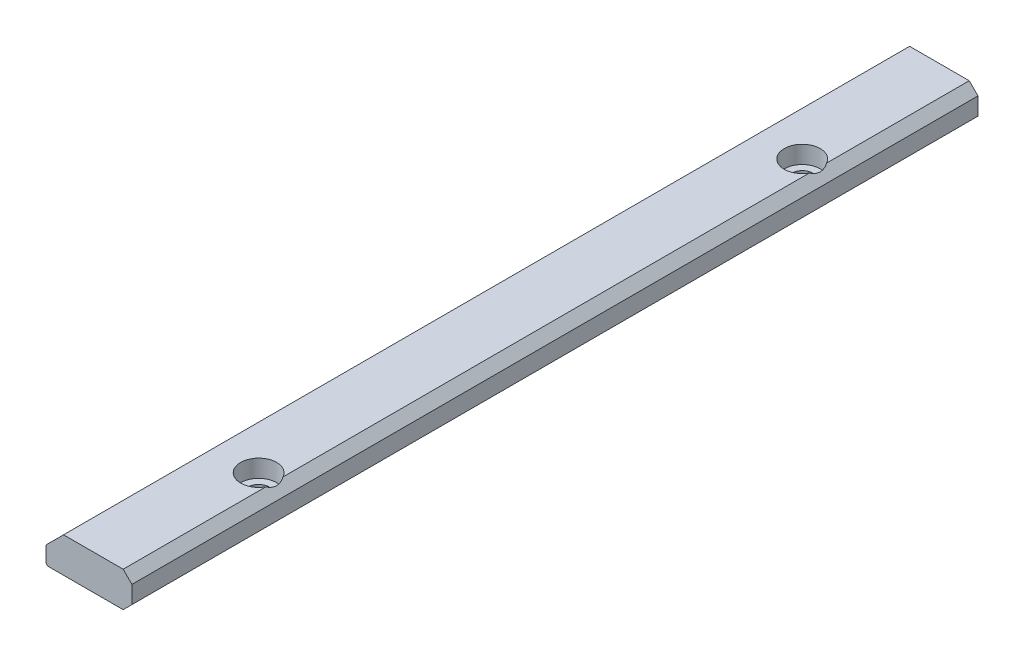
from build123d import *

# Parameters (mm, degrees)
EXTRUDE_1_DEPTH          = 96.5
CHAMFER_1_SIZE           = 1
CHAMFER_2_SIZE           = 1
CUT_EXTRUDE_1_DEPTH      = 98.010617976
CUT_EXTRUDE_1_DEPTH_BACK = 10
SKETCH_2_R               = 1.2
SKETCH_2_3_R             = 2.05
CUT_EXTRUDE_2_DEPTH      = 2
CHAMFER_3_SIZE           = 2
SKETCH_3_W               = 1.8
SKETCH_3_H               = 7.4
CUT_EXTRUDE_3_DEPTH      = 1.9
CHAMFER_4_SIZE           = 0.2
CHAMFER_5_SIZE           = 0.6


with BuildPart() as part:
    # 草图1 → 凸台-拉伸1 (new body)
    with BuildSketch(Plane.XY):
        Polygon((0, 0), (8, 0), (8, 4), (0, 4), (-1.8, 4), (-1.8, -1.9), (0, -1.9), align=None)
    extrude(amount=-EXTRUDE_1_DEPTH)

    # 倒角1
    chamfer_1_edges = [part.edges().sort_by_distance(p)[0] for p in [
        (8, 0, -48.25),
    ]]
    chamfer(chamfer_1_edges, length=CHAMFER_1_SIZE)

    # 倒角2
    chamfer_2_edges = [part.edges().sort_by_distance(p)[0] for p in [
        (8, 4, -48.25),
    ]]
    chamfer(chamfer_2_edges, length=CHAMFER_2_SIZE)

    # 草图2 → 切除-拉伸1 (cut, two sides: drawn at the far end of the back side and taken through both)
    with BuildSketch(Plane(origin=(0, 4, 0), x_dir=(1, 0, 0), z_dir=(0, 1, 0)).offset(-CUT_EXTRUDE_1_DEPTH_BACK)):
        with Locations(Location((5.2, 79.25, 0), (0, 0, 90))):
            Circle(SKETCH_2_R)
        with Locations(Location((5.2, 17.25, 0), (0, 0, 90))):
            Circle(SKETCH_2_R)
    extrude(amount=CUT_EXTRUDE_1_DEPTH + CUT_EXTRUDE_1_DEPTH_BACK, mode=Mode.SUBTRACT)

    # 草图2<3> → 切除-拉伸2 (cut)
    with BuildSketch(Plane(origin=(0, 4, 0), x_dir=(1, 0, 0), z_dir=(0, 1, 0))):
        with Locations(Location((5.2, 79.25, 0), (0, 0, 270))):
            Circle(SKETCH_2_3_R)
        with Locations(Location((5.2, 17.25, 0), (0, 0, 270))):
            Circle(SKETCH_2_3_R)
    extrude(amount=-CUT_EXTRUDE_2_DEPTH, mode=Mode.SUBTRACT)

    # 倒角3
    chamfer_3_edges = [part.edges().sort_by_distance(p)[0] for p in [
        (-1.8, 4, -48.25),
    ]]
    chamfer(chamfer_3_edges, length=CHAMFER_3_SIZE)

    # 草图3 → 切除-拉伸3 (cut)
    with BuildSketch(Plane.XZ.offset(1.9)):
        with Locations((-0.9, -92.8)):
            Rectangle(SKETCH_3_W, SKETCH_3_H)
        with Locations((-0.9, -3.7)):
            Rectangle(SKETCH_3_W, SKETCH_3_H)
    extrude(amount=-CUT_EXTRUDE_3_DEPTH, mode=Mode.SUBTRACT)

    # 倒角4
    chamfer_4_edges = [part.edges().sort_by_distance(p)[0] for p in [
        (-1.8, -1.9, -48.25),
        (0, -1.9, -48.25),
        (-1.8, -0.95, -89.1),
        (0, -0.95, -89.1),
        (-1.8, 0, -92.8),
        (-1.8, -0.95, -7.4),
        (0, -0.95, -7.4),
        (-1.8, 0, -3.7),
    ]]
    chamfer(chamfer_4_edges, length=CHAMFER_4_SIZE)

    # 倒角5
    # the kernel refuses this chamfer: 0.6 mm, written as the material it takes off along each edge
    with BuildSketch(Plane(origin=(1.343009793, -1.9, -89.1), x_dir=(0, 0.9996219169112965, -0.027495876610595982), z_dir=(-1, 0, 0))) as chamfer_5_piece_1:
        Polygon((CHAMFER_5_SIZE * 0.999621916911, -CHAMFER_5_SIZE * 0.0274958766106), (-CHAMFER_5_SIZE * 0.0274958766106, -CHAMFER_5_SIZE * 0.999621916911), (0, 0), align=None)
    extrude(amount=4.486019586, mode=Mode.SUBTRACT)
    with BuildSketch(Plane(origin=(1.343009793, -1.9, -7.4), x_dir=(0, 0.9996219169112968, 0.027495876610585925), z_dir=(-1, 0, 0))) as chamfer_5_piece_2:
        Polygon((CHAMFER_5_SIZE * 0.999621916911, CHAMFER_5_SIZE * 0.0274958766106), (-CHAMFER_5_SIZE * 0.0274958766106, CHAMFER_5_SIZE * 0.999621916911), (0, 0), align=None)
    extrude(amount=4.486019586, mode=Mode.SUBTRACT)


solid = part.part
